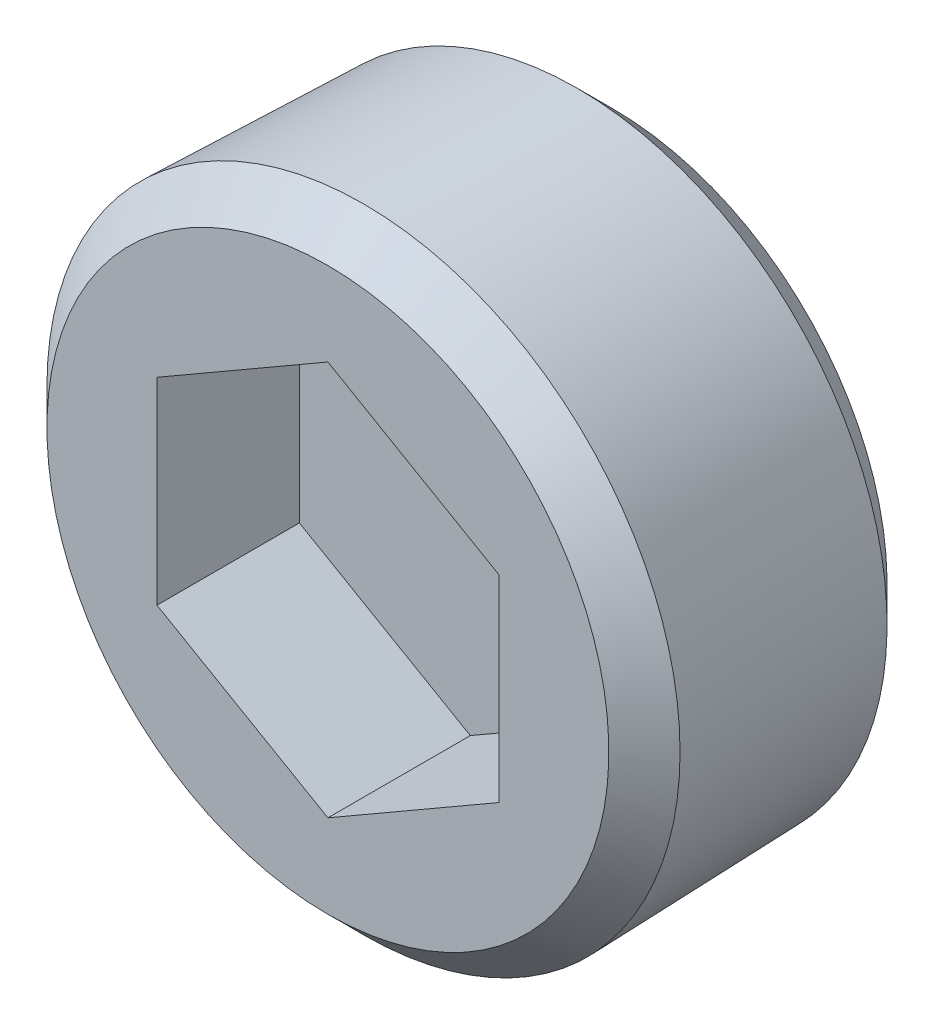
from build123d import *

# Parameters (mm, degrees)
CUT_EXTRUDE1_DEPTH = 6


with BuildPart() as part:
    # Sketch1 → Revolve1 (revolve)
    with BuildSketch(Plane(origin=(0, 0, 0), x_dir=(0, 0, -1), z_dir=(1, 0, 0))):
        Polygon((0, 0), (0, 11.55405041), (-1.5, 13.05405041), (-10.5, 13.335), (-12, 11.835), (-12, 0), align=None)
    revolve(axis=Axis((0, 0, 0), (0, 0, 1)))

    # Sketch2 → Cut-Extrude1 (cut)
    with BuildSketch(Plane.XY.offset(12)):
        Polygon((0, -8.313843876), (7.2, -4.156921938), (7.2, 4.156921938), (0, 8.313843876), (-7.2, 4.156921938), (-7.2, -4.156921938), align=None)
    extrude(amount=-CUT_EXTRUDE1_DEPTH, mode=Mode.SUBTRACT)


solid = part.part
